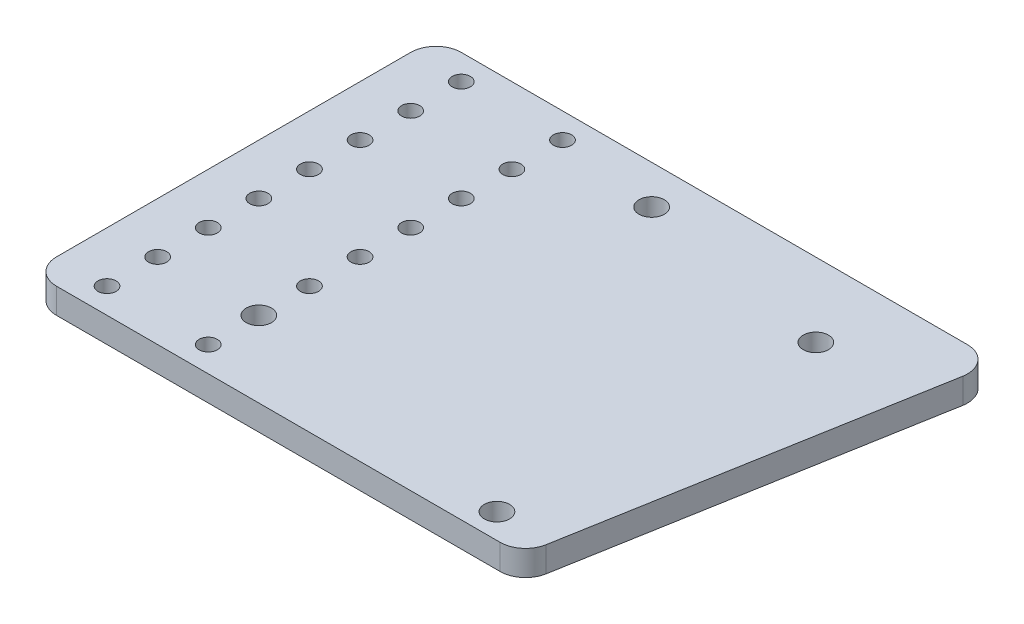
from build123d import *

# Parameters (mm, degrees)
INITIAL_PLATE_DEPTH         = 6.35
SKETCH3_R                   = 2.286
INITIAL_MOUNTING_HOLE_DEPTH = 93.996030901
MOUNTING_PATTERN_COUNT      = 8
MOUNTING_PATTERN_PITCH      = 12.7
SKETCH2_R                   = 3.175
BEARING_STACK_HOLES_DEPTH   = 93.996030901
FILLET1_R                   = 6.35


with BuildPart() as part:
    # Sketch1 → Initial Plate (new body)
    with BuildSketch(Plane(origin=(0, 0, 0), x_dir=(1, 0, 0), z_dir=(0, 1, 0))):
        Polygon((-65.702402442, -47.353082841), (57.352776318, -47.353082841), (75.267597558, 54.246917159), (-65.702402442, 54.246917159), align=None)
    extrude(amount=INITIAL_PLATE_DEPTH)

    # Sketch3 → Initial Mounting Hole (cut, through all)
    with BuildSketch(Plane(origin=(0, 6.35, 0), x_dir=(1, 0, 0), z_dir=(0, 1, 0))):
        with Locations((-53.002402442, -41.003082841)):
            Circle(SKETCH3_R)
        with Locations((-27.602402442, -41.003082841)):
            Circle(SKETCH3_R)
    initial_mounting_hole = extrude(amount=-INITIAL_MOUNTING_HOLE_DEPTH, mode=Mode.SUBTRACT)

    # Mounting Pattern: Initial Mounting Hole ×8
    with Locations(*[(0, 0, -i * MOUNTING_PATTERN_PITCH) for i in range(1, MOUNTING_PATTERN_COUNT)]):
        add(initial_mounting_hole, mode=Mode.SUBTRACT)

    # Sketch2 → Bearing Stack Holes (cut, through all)
    with BuildSketch(Plane(origin=(0, 6.35, 0), x_dir=(1, 0, 0), z_dir=(0, 1, 0))):
        with Locations((-27.602402442, -28.303082841)):
            Circle(SKETCH2_R)
        with Locations((48.164881012, 35.712608656)):
            Circle(SKETCH2_R)
        with Locations((44.938536645, -41.094007608)):
            Circle(SKETCH2_R)
        with Locations((-1.863352841, 44.533936082)):
            Circle(SKETCH2_R)
    extrude(amount=-BEARING_STACK_HOLES_DEPTH, mode=Mode.SUBTRACT)

    # Fillet1
    fillet1_edges = [part.edges().sort_by_distance(p)[0] for p in [
        (75.267597558, 3.175, -54.246917159),
        (57.352776318, 3.175, 47.353082841),
        (-65.702402442, 3.175, 47.353082841),
        (-65.702402442, 3.175, -54.246917159),
    ]]
    fillet(fillet1_edges, radius=FILLET1_R)


solid = part.part
